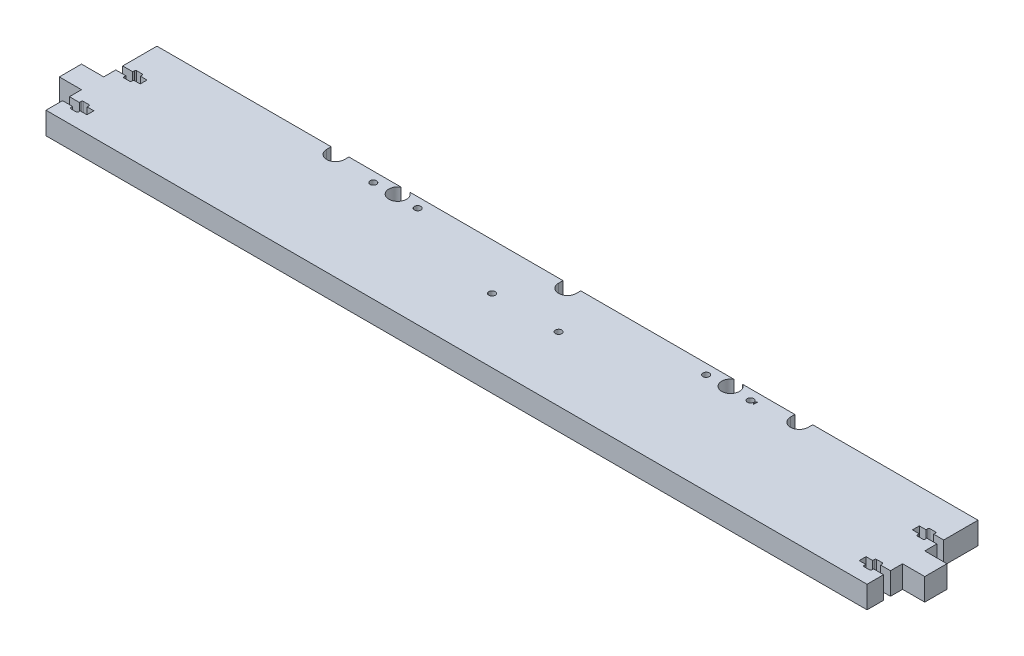
from build123d import *

# Parameters (mm, degrees)
MAINBODY_DEPTH                 = 10
SCREWCUTOUTS_DEPTH             = 197.85019685
SKETCH3_R                      = 4
SKETCH3_R_2                    = 1.45
RODCUTOUTS_DEPTH               = 197.85019685
SKETCH6_R                      = 1.45
CUT_EXTRUDE1_DEPTH             = 197.85019685
BEDADJUSTMENTSCREWCUTOUT_DEPTH = 197.85019685
DIRECTIONKEY_DEPTH             = 197.85019685
CUT_EXTRUDE2_DEPTH             = 197.85019685


with BuildPart() as part:
    # Sketch1 → MainBody (new body)
    with BuildSketch(Plane(origin=(0, 0, 0), x_dir=(1, 0, 0), z_dir=(0, 1, 0))):
        Polygon((0, -25), (0, 25), (-185, 25), (-185, 1), (-195, 1), (-195, -9), (-185, -9), (-185, -25), align=None)
    mainbody = extrude(amount=MAINBODY_DEPTH)

    # Sketch5 → ScrewCutouts (cut, through all)
    with BuildSketch(Plane(origin=(0, 10, 0), x_dir=(1, 0, 0), z_dir=(0, 1, 0))):
        with BuildLine():
            Line((-185, 9.55), (-180.5, 9.55))
            Line((-180.5, 9.55), (-180.5, 10.35))
            ThreePointArc((-180.5, 10.35), (-180.353553391, 10.703553391), (-180, 10.85))
            Line((-180, 10.85), (-177.5, 10.85))
            ThreePointArc((-177.5, 10.85), (-177.146446609, 10.703553391), (-177, 10.35))
            Line((-177, 10.35), (-177, 9.55))
            Line((-177, 9.55), (-174, 9.55))
            Line((-174, 9.55), (-174, 6.45))
            Line((-174, 6.45), (-177, 6.45))
            Line((-177, 6.45), (-177, 5.65))
            ThreePointArc((-177, 5.65), (-177.146446609, 5.296446609), (-177.5, 5.15))
            Line((-177.5, 5.15), (-180, 5.15))
            ThreePointArc((-180, 5.15), (-180.353553391, 5.296446609), (-180.5, 5.65))
            Line((-180.5, 5.65), (-180.5, 6.45))
            Line((-180.5, 6.45), (-185, 6.45))
            Line((-185, 6.45), (-185, 9.55))
        make_face()
        with BuildLine():
            Line((-185, -14.45), (-180.5, -14.45))
            Line((-180.5, -14.45), (-180.5, -13.65))
            ThreePointArc((-180.5, -13.65), (-180.353553391, -13.296446609), (-180, -13.15))
            Line((-180, -13.15), (-177.5, -13.15))
            ThreePointArc((-177.5, -13.15), (-177.146446609, -13.296446609), (-177, -13.65))
            Line((-177, -13.65), (-177, -14.45))
            Line((-177, -14.45), (-174, -14.45))
            Line((-174, -14.45), (-174, -17.55))
            Line((-174, -17.55), (-177, -17.55))
            Line((-177, -17.55), (-177, -18.35))
            ThreePointArc((-177, -18.35), (-177.146446609, -18.703553391), (-177.5, -18.85))
            Line((-177.5, -18.85), (-180, -18.85))
            ThreePointArc((-180, -18.85), (-180.353553391, -18.703553391), (-180.5, -18.35))
            Line((-180.5, -18.35), (-180.5, -17.55))
            Line((-180.5, -17.55), (-185, -17.55))
            Line((-185, -17.55), (-185, -14.45))
        make_face()
    screwcutouts = extrude(amount=-SCREWCUTOUTS_DEPTH, mode=Mode.SUBTRACT)

    # Mirror1: MainBody, ScrewCutouts across plane
    add(mainbody.mirror(Plane(origin=(0, 0, 0), x_dir=(0, 0, 1), z_dir=(1, 0, 0))))
    add(screwcutouts.mirror(Plane(origin=(0, 0, 0), x_dir=(0, 0, 1), z_dir=(1, 0, 0))), mode=Mode.SUBTRACT)

    # Sketch3 → RodCutouts (cut, through all)
    with BuildSketch(Plane(origin=(0, 10, 0), x_dir=(1, 0, 0), z_dir=(0, 1, 0))):
        with Locations((-73, 21.5)):
            Circle(SKETCH3_R)
        with Locations((-83, 20.5)):
            Circle(SKETCH3_R_2)
        with Locations((-63, 20.5)):
            Circle(SKETCH3_R_2)
        with Locations((67, 20.5)):
            Circle(SKETCH3_R_2)
        with Locations((87, 20.5)):
            Circle(SKETCH3_R_2)
        with Locations((77, 21.5)):
            Circle(SKETCH3_R)
    extrude(amount=-RODCUTOUTS_DEPTH, mode=Mode.SUBTRACT)

    # Sketch6 → Cut-Extrude1 (cut, through all)
    with BuildSketch(Plane(origin=(0, 10, 0), x_dir=(1, 0, 0), z_dir=(0, 1, 0))):
        with Locations((-13, 4)):
            Circle(SKETCH6_R)
        with Locations((17, 4)):
            Circle(SKETCH6_R)
    extrude(amount=-CUT_EXTRUDE1_DEPTH, mode=Mode.SUBTRACT)

    # Sketch7 → BedAdjustmentScrewCutout (cut, through all)
    with BuildSketch(Plane(origin=(0, 10, 0), x_dir=(1, 0, 0), z_dir=(0, 1, 0))):
        with BuildLine():
            Line((-98.5, 25), (-98.5, 23))
            ThreePointArc((-98.5, 23), (-102.5, 19), (-106.5, 23))
            Line((-106.5, 23), (-106.5, 25))
            ThreePointArc((-106.5, 25), (-102.5, 29), (-98.5, 25))
        make_face()
        with BuildLine():
            Line((102.5, 25), (102.5, 23))
            ThreePointArc((102.5, 23), (106.5, 19), (110.5, 23))
            Line((110.5, 23), (110.5, 25))
            ThreePointArc((110.5, 25), (106.5, 29), (102.5, 25))
        make_face()
    extrude(amount=-BEDADJUSTMENTSCREWCUTOUT_DEPTH, mode=Mode.SUBTRACT)

    # Sketch8 → DirectionKey (cut, through all)
    with BuildSketch(Plane(origin=(0, 10, 0), x_dir=(1, 0, 0), z_dir=(0, 1, 0))):
        Polygon((88.25, 20.5), (89.25, 21.5), (89.25, 19.5), align=None)
    extrude(amount=-DIRECTIONKEY_DEPTH, mode=Mode.SUBTRACT)

    # Sketch9 → Cut-Extrude2 (cut, through all)
    with BuildSketch(Plane(origin=(0, 10, 0), x_dir=(1, 0, 0), z_dir=(0, 1, 0))):
        with BuildLine():
            Line((6, 27), (6, 23))
            ThreePointArc((6, 23), (2, 19), (-2, 23))
            Line((-2, 23), (-2, 27))
            ThreePointArc((-2, 27), (2, 31), (6, 27))
        make_face()
    extrude(amount=-CUT_EXTRUDE2_DEPTH, mode=Mode.SUBTRACT)


solid = part.part
